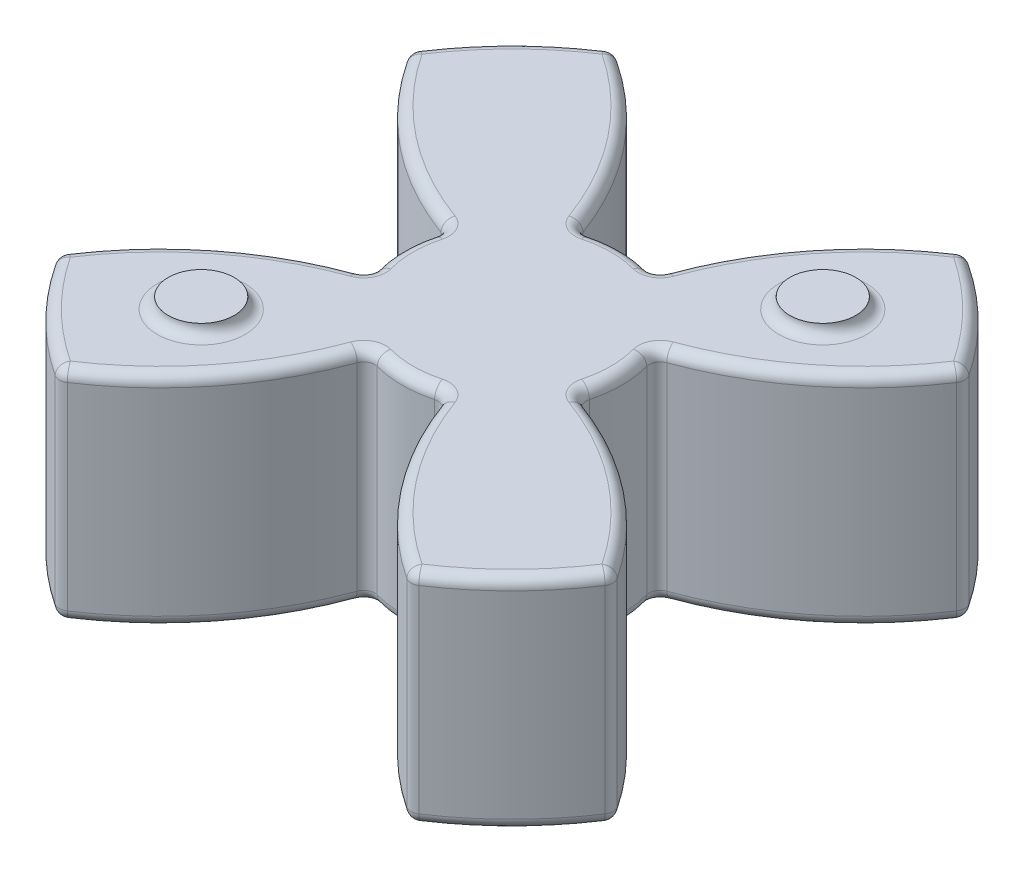
from build123d import *

# Parameters (mm, degrees)
SKETCH1_R      = 15
EXTRUDE1_DEPTH = 5
EXTRUDE2_START = -10
EXTRUDE2_DEPTH = 10
SKETCH4_R      = 1.5
EXTRUDE3_DEPTH = 0.5
FILLET1_R      = 0.5


# Read off the part's stored shape, not the designer's step: Extrude2
with BuildPart() as part:
    # Sketch1 → Extrude1 (new, symmetric)
    with BuildSketch(Plane(origin=(0, 0, 0), x_dir=(1, 0, 0), z_dir=(0, 1, 0))):
        with Locations(Location((0, 0, 0), (0, 0, 270))):
            Circle(SKETCH1_R)
    extrude(amount=EXTRUDE1_DEPTH, both=True)

    # Extrude2 outline → Extrude2 (cut)
    with BuildSketch(Plane.XZ.offset(5).offset(EXTRUDE2_START)):
        with BuildLine():
            ThreePointArc((-1.75, 4.683748499), (0, 5), (1.75, 4.683748499))
            ThreePointArc((1.75, 4.683748499), (4.176931574, 9.231199976), (8, 12.68857754))
            ThreePointArc((8, 12.68857754), (0, 15), (-8, 12.68857754))
            ThreePointArc((-8, 12.68857754), (-4.176931574, 9.231199976), (-1.75, 4.683748499))
        make_face()
        with BuildLine():
            ThreePointArc((12.68857754, -8), (15, 0), (12.68857754, 8))
            ThreePointArc((12.68857754, 8), (9.231199976, 4.176931574), (4.683748499, 1.75))
            ThreePointArc((4.683748499, 1.75), (5, 0), (4.683748499, -1.75))
            ThreePointArc((4.683748499, -1.75), (9.231199976, -4.176931574), (12.68857754, -8))
        make_face()
        with BuildLine():
            ThreePointArc((-4.683748499, 1.75), (-9.231199976, 4.176931574), (-12.68857754, 8))
            ThreePointArc((-12.68857754, 8), (-15, 0), (-12.68857754, -8))
            ThreePointArc((-12.68857754, -8), (-9.231199976, -4.176931574), (-4.683748499, -1.75))
            ThreePointArc((-4.683748499, -1.75), (-5, 0), (-4.683748499, 1.75))
        make_face()
        with BuildLine():
            ThreePointArc((-1.75, -4.683748499), (-4.176931574, -9.231199976), (-8, -12.68857754))
            ThreePointArc((-8, -12.68857754), (0, -15), (8, -12.68857754))
            ThreePointArc((8, -12.68857754), (4.176931574, -9.231199976), (1.75, -4.683748499))
            ThreePointArc((1.75, -4.683748499), (0, -5), (-1.75, -4.683748499))
        make_face()
    extrude(amount=EXTRUDE2_DEPTH, mode=Mode.SUBTRACT)

    # Sketch4 → Extrude3 (add)
    with BuildSketch(Plane(origin=(0, 5, 0), x_dir=(1, 0, 0), z_dir=(0, 1, 0))):
        with Locations(Location((7.071067812, 7.071067812, 0), (0, 0, 270))):
            Circle(SKETCH4_R)
        with Locations(Location((-7.071067812, -7.071067812, 0), (0, 0, 270))):
            Circle(SKETCH4_R)
    extrude3 = extrude(amount=EXTRUDE3_DEPTH)

    # Mirror1: Extrude3 across plane
    add(extrude3.mirror(Plane.ZX))

    # Fillet1
    fillet1_edges = [part.edges().sort_by_distance(p)[0] for p in [
        (10.606601718, 5, -10.606601718),
        (-10.606601718, 5, -10.606601718),
        (-10.606601718, 5, 10.606601718),
        (10.606601718, -5, 10.606601718),
        (4.176931574, 5, 9.231199976),
        (1.75, 0, 4.683748499),
        (8, 0, 12.68857754),
        (9.231199976, 5, 4.176931574),
        (12.68857754, 0, 8),
        (5, 5, 0),
        (4.683748499, 0, 1.75),
        (9.231199976, 5, -4.176931574),
        (4.683748499, 0, -1.75),
        (12.68857754, 0, -8),
        (4.176931574, 5, -9.231199976),
        (8, 0, -12.68857754),
        (0, 5, -5),
        (1.75, 0, -4.683748499),
        (-4.176931574, 5, -9.231199976),
        (-1.75, 0, -4.683748499),
        (-8, 0, -12.68857754),
        (-9.231199976, 5, -4.176931574),
        (-12.68857754, 0, -8),
        (-5, 5, 0),
        (-4.683748499, 0, -1.75),
        (-9.231199976, 5, 4.176931574),
        (-4.683748499, 0, 1.75),
        (-12.68857754, 0, 8),
        (-4.176931574, 5, 9.231199976),
        (-8, 0, 12.68857754),
        (0, 5, 5),
        (-1.75, 0, 4.683748499),
        (4.176931574, -5, 9.231199976),
        (0, -5, 5),
        (-4.176931574, -5, 9.231199976),
        (-9.231199976, -5, 4.176931574),
        (-5, -5, 0),
        (-9.231199976, -5, -4.176931574),
        (-4.176931574, -5, -9.231199976),
        (0, -5, -5),
        (4.176931574, -5, -9.231199976),
        (9.231199976, -5, -4.176931574),
        (5, -5, 0),
        (9.231199976, -5, 4.176931574),
        (10.606601718, 5, 10.606601718),
        (10.606601718, -5, -10.606601718),
        (7.071067812, 5, -8.571067812),
        (-10.606601718, -5, -10.606601718),
        (-7.071067812, 5, 5.571067812),
        (-10.606601718, -5, 10.606601718),
        (7.071067812, -5, -8.571067812),
        (-7.071067812, -5, 5.571067812),
    ]]
    fillet(fillet1_edges, radius=FILLET1_R - 0.0001)  # a hair under: the kernel refuses the full size


solid = part.part
